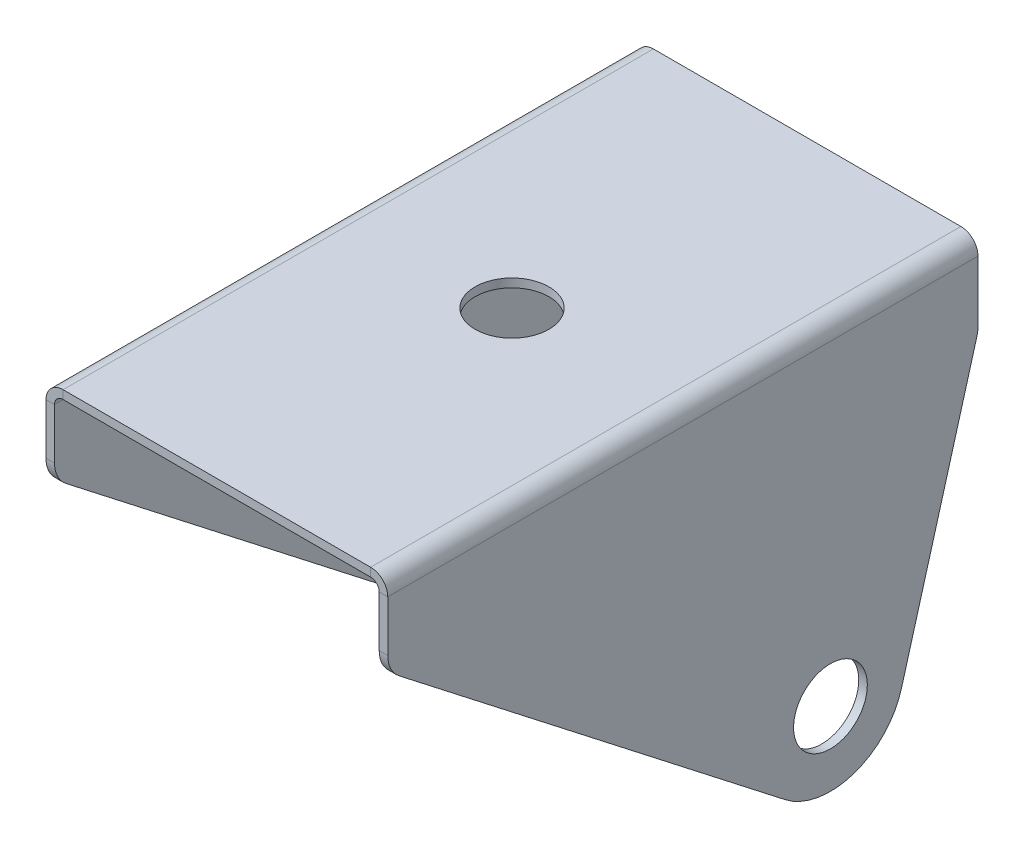
from build123d import *

# Parameters (mm, degrees)
SKETCH1_W                    = 27.94
SKETCH1_H                    = 50.8
BASE_FLANGE1_DEPTH           = 0.7366
EDGE_FLANGE1_STRIP_W         = 4.4196
EDGE_FLANGE1_STRIP_H         = 0.7366
EDGE_FLANGE1_STRIP_CUT_DEPTH = 50.8
EDGE_FLANGE1_DEPTH           = 50.8
EDGE_FLANGE1_START           = 0.7366
EDGE_FLANGE1_FLAT_DEPTH      = 0.7366
SKETCH12_R                   = 3.175
CUT_EXTRUDE1_DEPTH           = 53.317865417
CUT_EXTRUDE2_REACH           = 47.698
SKETCH13_R                   = 3.175


# Sheet-metal steps are written as plain solids
with BuildPart() as part:
    # Sketch1 → Base-Flange1 (new body)
    with BuildSketch(Plane(origin=(0, 0, 0), x_dir=(1, 0, 0), z_dir=(0, 1, 0))):
        Rectangle(SKETCH1_W, SKETCH1_H)
    extrude(amount=-BASE_FLANGE1_DEPTH)

    # Edge-Flange1 strip (across the edge) → Edge-Flange1 strip cut (cut)
    with BuildSketch(Plane(origin=(13.97, -0.7366, -25.4), x_dir=(-1, 0, 0), z_dir=(0, 0, 1))):
        with Locations((-1.4732, -0.3683)):
            Rectangle(EDGE_FLANGE1_STRIP_W, EDGE_FLANGE1_STRIP_H)
    edge_flange1_strip_cut = extrude(amount=EDGE_FLANGE1_STRIP_CUT_DEPTH, mode=Mode.SUBTRACT)

    # Edge-Flange1 bend section (across the edge) → Edge-Flange1 (add)
    with BuildSketch(Plane(origin=(13.97, -0.7366, -25.4), x_dir=(-1, 0, 0), z_dir=(0, 0, 1))):
        with BuildLine():
            Line((-0.7366, 0.7366), (0, 0.7366))
            ThreePointArc((0, 0.7366), (0.215745145, 0.215745145), (0.7366, 0))
            Line((0.7366, 0), (0.7366, -0.7366))
            ThreePointArc((0.7366, -0.7366), (-0.30510971, -0.30510971), (-0.7366, 0.7366))
        make_face()
    edge_flange1 = extrude(amount=EDGE_FLANGE1_DEPTH)

    # Edge-Flange1 profile (on flange) → Edge-Flange1 flat (add)
    with BuildSketch(Plane(origin=(13.97, -0.7366, 0), x_dir=(0, 0, 1), z_dir=(1, 0, 0)).offset(EDGE_FLANGE1_START)):
        with BuildLine():
            Line((24.419454366, 7.112682089), (-8.801364085, 32.952298674))
            ThreePointArc((-8.801364085, 32.952298674), (-14.680352055, 33.973299739), (-18.810680555, 29.666870915))
            Line((-18.810680555, 29.666870915), (-25.304272222, 6.688740937))
            ThreePointArc((-25.304272222, 6.688740937), (-25.375954237, 6.346667603), (-25.4, 5.997992571))
            Line((-25.4, 5.997992571), (-25.4, 0.7366))
            Line((-25.4, 0.7366), (25.4, 0.7366))
            Line((25.4, 0.7366), (25.4, 5.10776262))
            ThreePointArc((25.4, 5.10776262), (25.141733342, 6.223689568), (24.419454366, 7.112682089))
        make_face()
    edge_flange1_flat = extrude(amount=-EDGE_FLANGE1_FLAT_DEPTH)

    # Mirror1: Edge-Flange1 strip cut, Edge-Flange1, Edge-Flange1 flat across plane
    add(edge_flange1_strip_cut.mirror(Plane(origin=(0, 0, 0), x_dir=(0, 0, 1), z_dir=(1, 0, 0))), mode=Mode.SUBTRACT)
    add(edge_flange1.mirror(Plane(origin=(0, 0, 0), x_dir=(0, 0, 1), z_dir=(1, 0, 0))))
    add(edge_flange1_flat.mirror(Plane(origin=(0, 0, 0), x_dir=(0, 0, 1), z_dir=(1, 0, 0))))

    # Sketch12 → Cut-Extrude1 (cut, through all)
    with BuildSketch(Plane.ZY.offset(14.7066)):
        with Locations(Location((-12.7, -28.6766, 0), (0, 0, 270))):
            Circle(SKETCH12_R)
    extrude(amount=-CUT_EXTRUDE1_DEPTH, mode=Mode.SUBTRACT)

    # Sketch13 → Cut-Extrude2 (cut, up to next)
    with BuildSketch(Plane(origin=(0, 0, 0), x_dir=(1, 0, 0), z_dir=(0, 1, 0)), mode=Mode.PRIVATE) as cut_extrude2_sk1:
        with Locations(Location((0, 0, 0), (0, 0, 270))):
            Circle(SKETCH13_R)
    cut_extrude2_tool1 = extrude(cut_extrude2_sk1.sketch, amount=-CUT_EXTRUDE2_REACH, mode=Mode.PRIVATE) & part.part
    add(cut_extrude2_tool1.solids().sort_by_distance((0, 0, 0))[0], mode=Mode.SUBTRACT)


solid = part.part
